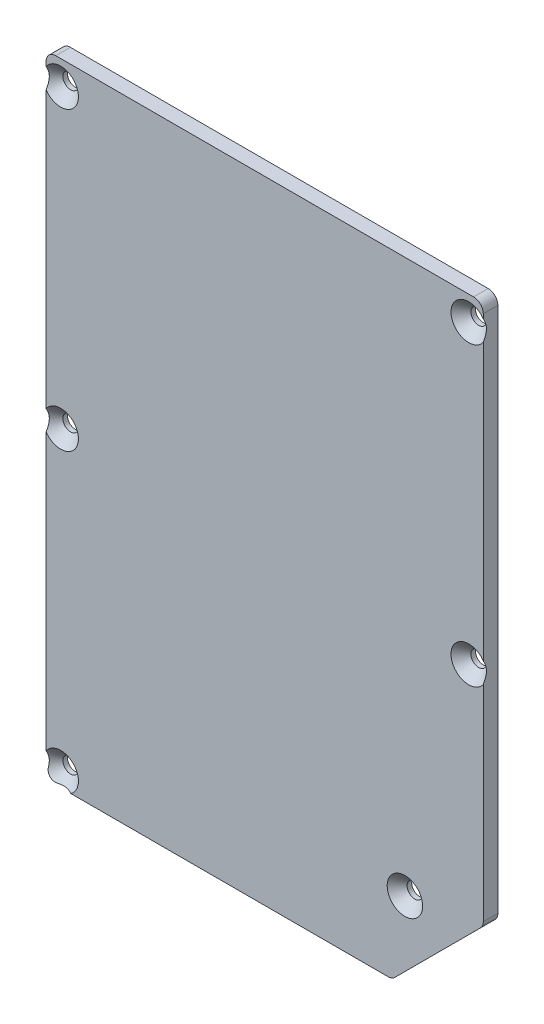
from build123d import *

# Parameters (mm, degrees)
BOSS_EXTRUDE1_DEPTH                                 = 3
CSK_FOR_M3_COUNTERSUNK_FLAT_HEAD_SCREW1_D           = 3.2
CSK_FOR_M3_COUNTERSUNK_FLAT_HEAD_SCREW1_DEPTH       = 5
CSK_FOR_M3_COUNTERSUNK_FLAT_HEAD_SCREW1_CSINK_D     = 7.3
CSK_FOR_M3_COUNTERSUNK_FLAT_HEAD_SCREW1_CSINK_ANGLE = 90
CSK_FOR_M3_COUNTERSUNK_FLAT_HEAD_SCREW1_TIP         = 0.96137699


with BuildPart() as part:
    # Sketch1 → Boss-Extrude1 (new body)
    with BuildSketch(Plane.XY):
        with BuildLine():
            Line((-43, 70), (43, 70))
            ThreePointArc((43, 70), (44.414213562, 69.414213562), (45, 68))
            Line((45, 68), (45, -40.384776311))
            ThreePointArc((45, -40.384776311), (44.847759065, -41.150143176), (44.414213562, -41.798989873))
            Line((44.414213562, -41.798989873), (26.798989873, -59.414213562))
            ThreePointArc((26.798989873, -59.414213562), (26.150143176, -59.847759065), (25.384776311, -60))
            Line((25.384776311, -60), (-43, -60))
            ThreePointArc((-43, -60), (-44.414213562, -59.414213562), (-45, -58))
            Line((-45, -58), (-45, 68))
            ThreePointArc((-45, 68), (-44.414213562, 69.414213562), (-43, 70))
        make_face()
    extrude(amount=BOSS_EXTRUDE1_DEPTH)

    # CSK for M3 Countersunk Flat Head Screw1
    with Locations(Plane(origin=(-42, -57, 3), x_dir=(1, 0, 0), z_dir=(0, 0, 1))):
        with Locations((0, 0), (70.863961031, 13.136038969), (84, 61), (0, 61), (0, 122), (84, 122)):
            CounterSinkHole(CSK_FOR_M3_COUNTERSUNK_FLAT_HEAD_SCREW1_D / 2, CSK_FOR_M3_COUNTERSUNK_FLAT_HEAD_SCREW1_CSINK_D / 2, depth=CSK_FOR_M3_COUNTERSUNK_FLAT_HEAD_SCREW1_DEPTH, counter_sink_angle=CSK_FOR_M3_COUNTERSUNK_FLAT_HEAD_SCREW1_CSINK_ANGLE)
            with Locations((0, 0, -(CSK_FOR_M3_COUNTERSUNK_FLAT_HEAD_SCREW1_DEPTH + CSK_FOR_M3_COUNTERSUNK_FLAT_HEAD_SCREW1_TIP / 2))):  # 118° drill point
                Cone(0, CSK_FOR_M3_COUNTERSUNK_FLAT_HEAD_SCREW1_D / 2, CSK_FOR_M3_COUNTERSUNK_FLAT_HEAD_SCREW1_TIP, mode=Mode.SUBTRACT)


solid = part.part
